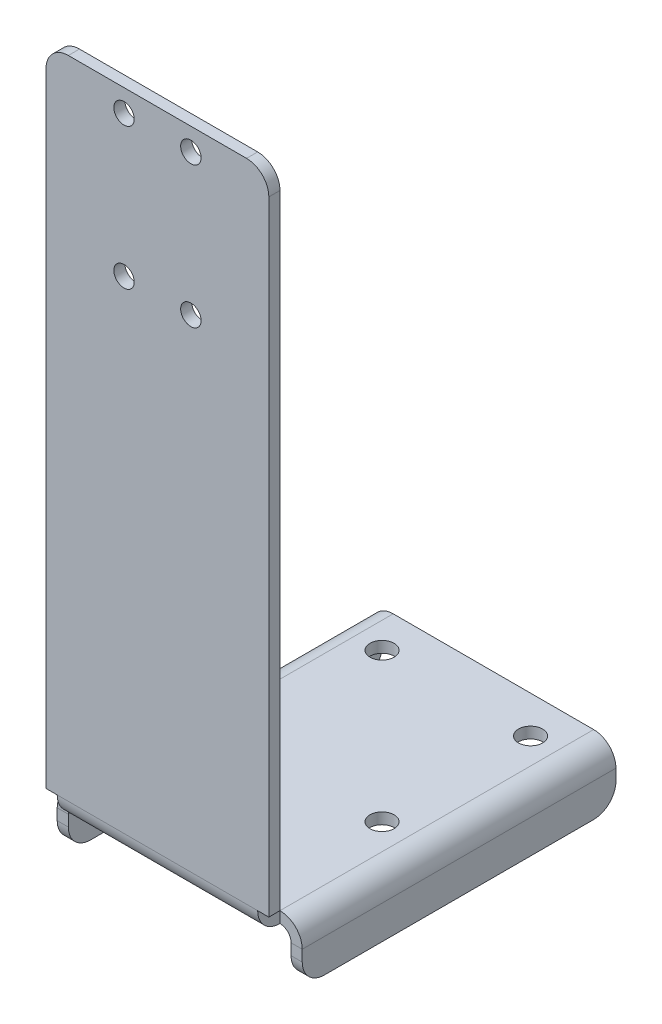
from build123d import *

# Parameters (mm, degrees)
SKIZZE1_W                        = 60
SKIZZE1_H                        = 180
BASIS_BLECH1_DEPTH               = 3
KANTE_LASCHE1_STRIP_W            = 18
KANTE_LASCHE1_STRIP_H            = 3
KANTE_LASCHE1_STRIP_CUT_DEPTH    = 60
KANTE_LASCHE1_DEPTH              = 60
KANTE_LASCHE2_START              = -90.5
KANTE_LASCHE2_DEPTH              = 90.5
KANTE_LASCHE2_START_2            = -6
KANTE_LASCHE2_2_DEPTH            = 6
KANTE_LASCHE2_3_DEPTH            = 84.5
ECKE_START                       = -33
ECKE_BRECHEN1_DEPTH              = 66
ECKE_START_2                     = -3
ECKE_BRECHEN1_2_DEPTH            = 3
F_6_5_6_5_DURCHMESSER_BOHRUNG1_D = 6.5
F_5_5_5_5_DURCHMESSER_BOHRUNG1_D = 5.5


# Read off the part's stored shape, not the designer's step: Kante-Lasche2, Ecke brechen1
# Sheet-metal steps are written as plain solids
with BuildPart() as part:
    # Skizze1 → Basis-Blech1 (new body)
    with BuildSketch(Plane.XY):
        Rectangle(SKIZZE1_W, SKIZZE1_H)
    extrude(amount=-BASIS_BLECH1_DEPTH)

    # Kante-Lasche1 strip (across the edge) → Kante-Lasche1 strip cut (cut)
    with BuildSketch(Plane(origin=(30, -90, -3), x_dir=(0, 1, 0), z_dir=(-1, 0, 0))):
        with Locations((-3, -1.5)):
            Rectangle(KANTE_LASCHE1_STRIP_W, KANTE_LASCHE1_STRIP_H)
    extrude(amount=KANTE_LASCHE1_STRIP_CUT_DEPTH, mode=Mode.SUBTRACT)

    # Kante-Lasche1 section (across the edge) → Kante-Lasche1 (add)
    with BuildSketch(Plane(origin=(30, -90, -3), x_dir=(0, 1, 0), z_dir=(-1, 0, 0))):
        with BuildLine():
            Line((0, 3), (0, 87.5))
            Line((0, 87.5), (3, 87.5))
            Line((3, 87.5), (3, 3))
            ThreePointArc((3, 3), (3.878679656, 0.878679656), (6, 0))
            Line((6, 0), (6, -3))
            ThreePointArc((6, -3), (1.757359313, -1.242640687), (0, 3))
        make_face()
    extrude(amount=KANTE_LASCHE1_DEPTH)

    # Kante-Lasche2 outline → Kante-Lasche2 (cut)
    with BuildSketch(Plane.XY.offset(KANTE_LASCHE2_START)):
        with BuildLine():
            Line((-27, -87), (-27, -84))
            Line((-27, -84), (-30, -84))
            Line((-30, -84), (-30, -87.803847577))
            ThreePointArc((-30, -87.803847577), (-28.552914271, -87.204445042), (-27, -87))
        make_face()
        with BuildLine():
            Line((30, -84), (27, -84))
            Line((27, -84), (27, -87))
            ThreePointArc((27, -87), (28.552914271, -87.204445042), (30, -87.803847577))
            Line((30, -87.803847577), (30, -84))
        make_face()
    extrude(amount=KANTE_LASCHE2_DEPTH, mode=Mode.SUBTRACT)

    # Kante-Lasche2 2 outline → Kante-Lasche2 2 (cut)
    with BuildSketch(Plane.XY.offset(KANTE_LASCHE2_START_2)):
        with BuildLine():
            Line((-27, -90), (-27, -87))
            ThreePointArc((-27, -87), (-28.552914271, -87.204445042), (-30, -87.803847577))
            ThreePointArc((-30, -87.803847577), (-32.196152423, -90), (-33, -93))
            Line((-33, -93), (-33, -102))
            Line((-33, -102), (-30, -102))
            Line((-30, -102), (-30, -93))
            ThreePointArc((-30, -93), (-29.121320344, -90.878679656), (-27, -90))
        make_face()
        with BuildLine():
            ThreePointArc((30, -87.803847577), (28.552914271, -87.204445042), (27, -87))
            Line((27, -87), (27, -90))
            ThreePointArc((27, -90), (29.121320344, -90.878679656), (30, -93))
            Line((30, -93), (30, -102))
            Line((30, -102), (33, -102))
            Line((33, -102), (33, -93))
            ThreePointArc((33, -93), (32.196152423, -90), (30, -87.803847577))
        make_face()
    extrude(amount=KANTE_LASCHE2_2_DEPTH, mode=Mode.SUBTRACT)

    # Kante-Lasche2 3 outline → Kante-Lasche2 3 (add)
    with BuildSketch(Plane.XY.offset(KANTE_LASCHE2_START)):
        with BuildLine():
            Line((-27, -90), (-27, -87))
            ThreePointArc((-27, -87), (-28.552914271, -87.204445042), (-30, -87.803847577))
            ThreePointArc((-30, -87.803847577), (-32.196152423, -90), (-33, -93))
            Line((-33, -93), (-33, -102))
            Line((-33, -102), (-30, -102))
            Line((-30, -102), (-30, -93))
            ThreePointArc((-30, -93), (-29.121320344, -90.878679656), (-27, -90))
        make_face()
        with BuildLine():
            ThreePointArc((30, -87.803847577), (28.552914271, -87.204445042), (27, -87))
            Line((27, -87), (27, -90))
            ThreePointArc((27, -90), (29.121320344, -90.878679656), (30, -93))
            Line((30, -93), (30, -102))
            Line((30, -102), (33, -102))
            Line((33, -102), (33, -93))
            ThreePointArc((33, -93), (32.196152423, -90), (30, -87.803847577))
        make_face()
    extrude(amount=KANTE_LASCHE2_3_DEPTH)

    # Ecke brechen1 outline → Ecke brechen1 (cut)
    with BuildSketch(Plane.YZ.offset(ECKE_START)):
        with BuildLine():
            ThreePointArc((-96, -90.5), (-100.242640687, -88.742640687), (-102, -84.5))
            Line((-102, -84.5), (-102, -90.5))
            Line((-102, -90.5), (-96, -90.5))
        make_face()
        with BuildLine():
            ThreePointArc((-102, -12), (-100.242640687, -7.757359313), (-96, -6))
            Line((-96, -6), (-102, -6))
            Line((-102, -6), (-102, -12))
        make_face()
    extrude(amount=ECKE_BRECHEN1_DEPTH, mode=Mode.SUBTRACT)

    # Ecke brechen1 2 outline → Ecke brechen1 2 (cut)
    with BuildSketch(Plane.XY.offset(ECKE_START_2)):
        with BuildLine():
            Line((30, 90), (24, 90))
            ThreePointArc((24, 90), (28.242640687, 88.242640687), (30, 84))
            Line((30, 84), (30, 90))
        make_face()
        with BuildLine():
            ThreePointArc((-30, 84), (-28.242640687, 88.242640687), (-24, 90))
            Line((-24, 90), (-30, 90))
            Line((-30, 90), (-30, 84))
        make_face()
    extrude(amount=ECKE_BRECHEN1_2_DEPTH, mode=Mode.SUBTRACT)

    # Ø6.5 (6.5) Durchmesser Bohrung1 (through all)
    with Locations(Plane(origin=(0, -87, 0), x_dir=(1, 0, 0), z_dir=(0, 1, 0))):
        with Locations((-20, 80.5), (20, 80.5), (-20, 40.5), (20, 40.5)):
            Hole(F_6_5_6_5_DURCHMESSER_BOHRUNG1_D / 2)

    # Ø5.5 (5.5) Durchmesser Bohrung1 (through all)
    with Locations(Plane(origin=(0, 0, -3), x_dir=(-1, 0, 0), z_dir=(0, 0, -1))):
        with Locations((-9, 84), (9, 84), (-9, 46), (9, 46)):
            Hole(F_5_5_5_5_DURCHMESSER_BOHRUNG1_D / 2)


solid = part.part
